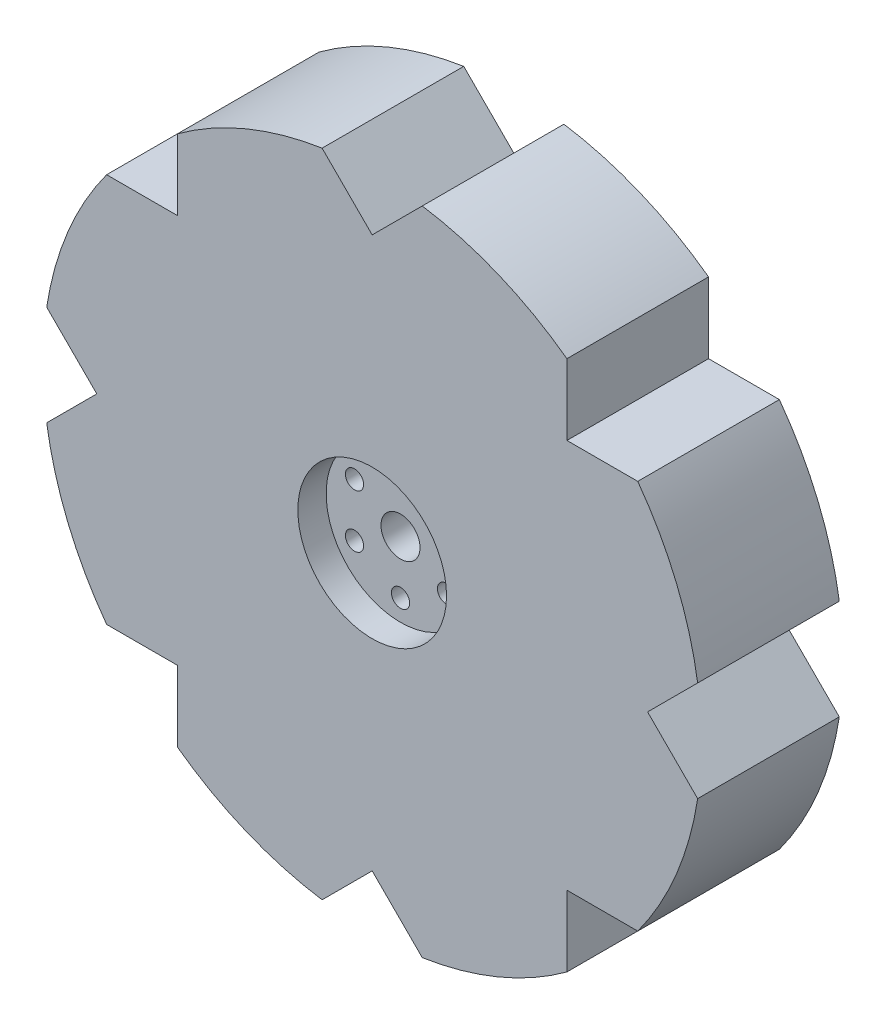
from build123d import *

# Parameters (mm, degrees)
BOSS_EXTRUDE1_DEPTH   = 25.4
SKETCH2_R             = 3.5
CUT_EXTRUDE1_DEPTH    = 87.364668991
SKETCH3_R             = 13.335
CUT_EXTRUDE2_DEPTH    = 5.08
SKETCH4_R             = 22.86
CUT_EXTRUDE3_DEPTH    = 5.08
F_4_CLEARANCE_HOLE1_D = 3.2639


with BuildPart() as part:
    # Sketch1 → Boss-Extrude1 (new body)
    with BuildSketch(Plane.XY):
        with BuildLine():
            Line((-8.980256121, 58.36821074), (0, 49.387954619))
            Line((0, 49.387954619), (8.980256121, 58.36821074))
            ThreePointArc((8.980256121, 58.36821074), (22.599370098, 54.559705792), (34.92255762, 47.62255762))
            Line((34.92255762, 47.62255762), (34.92255762, 34.92255762))
            Line((34.92255762, 34.92255762), (47.62255762, 34.92255762))
            ThreePointArc((47.62255762, 34.92255762), (54.559705792, 22.599370098), (58.36821074, 8.980256121))
            Line((58.36821074, 8.980256121), (49.387954619, 0))
            Line((49.387954619, 0), (58.36821074, -8.980256121))
            ThreePointArc((58.36821074, -8.980256121), (54.559705792, -22.599370098), (47.62255762, -34.92255762))
            Line((47.62255762, -34.92255762), (34.92255762, -34.92255762))
            Line((34.92255762, -34.92255762), (34.92255762, -47.62255762))
            ThreePointArc((34.92255762, -47.62255762), (22.599370098, -54.559705792), (8.980256121, -58.36821074))
            Line((8.980256121, -58.36821074), (0, -49.387954619))
            Line((0, -49.387954619), (-8.980256121, -58.36821074))
            ThreePointArc((-8.980256121, -58.36821074), (-22.599370098, -54.559705792), (-34.92255762, -47.62255762))
            Line((-34.92255762, -47.62255762), (-34.92255762, -34.92255762))
            Line((-34.92255762, -34.92255762), (-47.62255762, -34.92255762))
            ThreePointArc((-47.62255762, -34.92255762), (-54.559705792, -22.599370098), (-58.36821074, -8.980256121))
            Line((-58.36821074, -8.980256121), (-49.387954619, 0))
            Line((-49.387954619, 0), (-58.36821074, 8.980256121))
            ThreePointArc((-58.36821074, 8.980256121), (-54.559705792, 22.599370098), (-47.62255762, 34.92255762))
            Line((-47.62255762, 34.92255762), (-34.92255762, 34.92255762))
            Line((-34.92255762, 34.92255762), (-34.92255762, 47.62255762))
            ThreePointArc((-34.92255762, 47.62255762), (-22.599370098, 54.559705792), (-8.980256121, 58.36821074))
        make_face()
    extrude(amount=BOSS_EXTRUDE1_DEPTH)

    # Sketch2 → Cut-Extrude1 (cut, through all)
    with BuildSketch(Plane.XY.offset(25.4)):
        Circle(SKETCH2_R)
    extrude(amount=-CUT_EXTRUDE1_DEPTH, mode=Mode.SUBTRACT)

    # Sketch3 → Cut-Extrude2 (cut)
    with BuildSketch(Plane.XY.offset(25.4)):
        Circle(SKETCH3_R)
    extrude(amount=-CUT_EXTRUDE2_DEPTH, mode=Mode.SUBTRACT)

    # Sketch4 → Cut-Extrude3 (cut)
    with BuildSketch(Plane(origin=(0, 0, 0), x_dir=(-1, 0, 0), z_dir=(0, 0, -1))):
        Circle(SKETCH4_R)
    extrude(amount=-CUT_EXTRUDE3_DEPTH, mode=Mode.SUBTRACT)

    # #4 Clearance Hole1 (through all)
    with Locations(Plane(origin=(0, 0, 5.08), x_dir=(-1, 0, 0), z_dir=(0, 0, -1))):
        with Locations((0, 9.525), (8.248891971, 4.7625), (8.248891971, -4.7625), (0, -9.525), (-8.248891971, 4.7625), (-8.248891971, -4.7625)):
            Hole(F_4_CLEARANCE_HOLE1_D / 2)


solid = part.part
